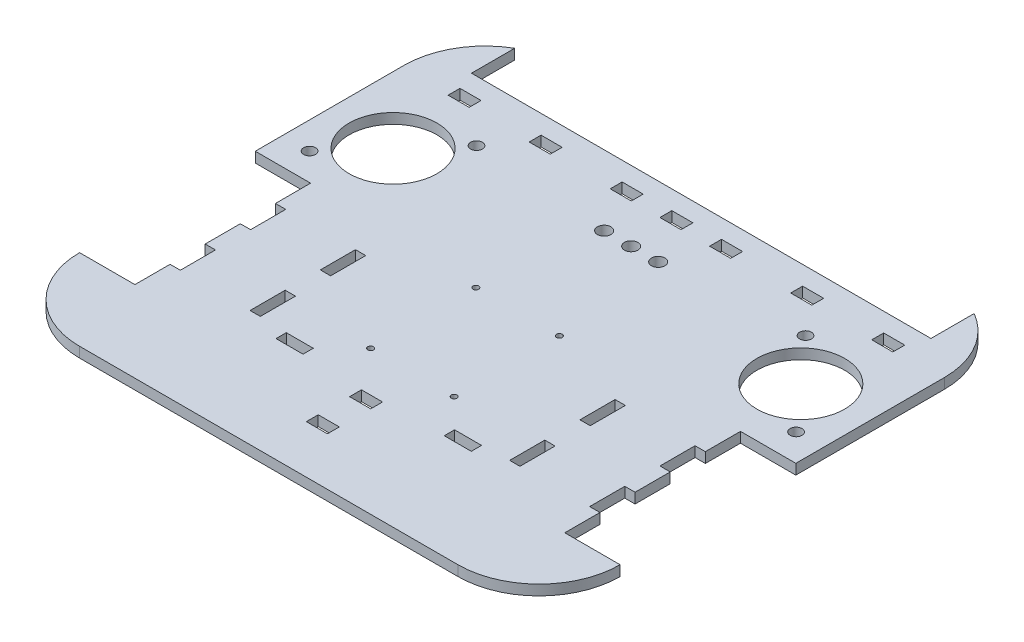
from build123d import *

# Parameters (mm, degrees)
SKETCH1_W           = 254
SKETCH1_H           = 228.6
BOSS_EXTRUDE1_DEPTH = 4.826
SKETCH2_W           = 26.00000007
SKETCH2_H           = 82.55
CUT_EXTRUDE1_DEPTH  = 4.826
CUT_EXTRUDE3_DEPTH  = 4.826
SKETCH7_W           = 215.9
SKETCH7_H           = 25.4
CUT_EXTRUDE5_DEPTH  = 4.826
CUT_EXTRUDE6_DEPTH  = 4.826
SKETCH10_W          = 4.826
SKETCH10_H          = 16.51
CUT_EXTRUDE8_DEPTH  = 171.929167423
SKETCH12_W          = 4.826
SKETCH12_H          = 16.51
CUT_EXTRUDE9_DEPTH  = 171.929167423
SKETCH13_W          = 4.826
SKETCH13_H          = 16.51
CUT_EXTRUDE10_DEPTH = 171.929167423
SKETCH15_R          = 1.3462
CUT_EXTRUDE11_DEPTH = 171.929167423
SKETCH16_R          = 2.778125
SKETCH16_R_2        = 20.6375
CUT_EXTRUDE12_DEPTH = 171.929167423
SKETCH17_W          = 9.906
SKETCH17_H          = 5.588
CUT_EXTRUDE13_DEPTH = 171.929167423
SKETCH18_W          = 9.906
SKETCH18_H          = 5.588
CUT_EXTRUDE14_DEPTH = 171.929167423
SKETCH19_R          = 3.175
CUT_EXTRUDE15_DEPTH = 171.929167423
SKETCH22_W          = 12.7
SKETCH22_H          = 4.826
CUT_EXTRUDE18_DEPTH = 171.929167423


with BuildPart() as part:
    # Sketch1 → Boss-Extrude1 (new body)
    with BuildSketch(Plane(origin=(0, 0, 0), x_dir=(1, 0, 0), z_dir=(0, 1, 0))):
        Rectangle(SKETCH1_W, SKETCH1_H)
    extrude(amount=BOSS_EXTRUDE1_DEPTH)

    # Sketch2 → Cut-Extrude1 (cut)
    with BuildSketch(Plane(origin=(0, 4.826, 0), x_dir=(1, 0, 0), z_dir=(0, 1, 0))):
        with Locations((-113.999999965, -34.925)):
            Rectangle(SKETCH2_W, SKETCH2_H)
        with Locations((113.999999965, -34.925)):
            Rectangle(SKETCH2_W, SKETCH2_H)
    extrude(amount=-CUT_EXTRUDE1_DEPTH, mode=Mode.SUBTRACT)

    # Sketch4 → Cut-Extrude3 (cut)
    with BuildSketch(Plane(origin=(0, 4.826, 0), x_dir=(1, 0, 0), z_dir=(0, 1, 0))):
        with BuildLine():
            Line((-127, 76.2), (-127, 114.3))
            Line((-127, 114.3), (-88.9, 114.3))
            ThreePointArc((-88.9, 114.3), (-115.840768363, 103.140768363), (-127, 76.2))
        make_face()
        with BuildLine():
            Line((127, 76.2), (127, 114.3))
            Line((127, 114.3), (88.9, 114.3))
            ThreePointArc((88.9, 114.3), (115.840768363, 103.140768363), (127, 76.2))
        make_face()
    extrude(amount=-CUT_EXTRUDE3_DEPTH, mode=Mode.SUBTRACT)

    # Sketch7 → Cut-Extrude5 (cut)
    with BuildSketch(Plane(origin=(0, 4.826, 0), x_dir=(1, 0, 0), z_dir=(0, 1, 0))):
        with Locations((0, 101.6)):
            Rectangle(SKETCH7_W, SKETCH7_H)
    extrude(amount=-CUT_EXTRUDE5_DEPTH, mode=Mode.SUBTRACT)

    # Sketch8 → Cut-Extrude6 (cut)
    with BuildSketch(Plane(origin=(0, 4.826, 0), x_dir=(1, 0, 0), z_dir=(0, 1, 0))):
        with BuildLine():
            Line((-127, -76.2), (-127, -114.3))
            Line((-127, -114.3), (-88.9, -114.3))
            ThreePointArc((-88.9, -114.3), (-115.840768363, -103.140768363), (-127, -76.2))
        make_face()
        with BuildLine():
            Line((127, -114.3), (88.9, -114.3))
            ThreePointArc((88.9, -114.3), (115.840768363, -103.140768363), (127, -76.2))
            Line((127, -76.2), (127, -114.3))
        make_face()
    extrude(amount=-CUT_EXTRUDE6_DEPTH, mode=Mode.SUBTRACT)

    # Sketch10 → Cut-Extrude8 (cut, through all)
    with BuildSketch(Plane(origin=(0, 4.826, 0), x_dir=(1, 0, 0), z_dir=(0, 1, 0))):
        with Locations((-98.58699993, -51.435)):
            Rectangle(SKETCH10_W, SKETCH10_H)
        with Locations((-98.58699993, -18.415)):
            Rectangle(SKETCH10_W, SKETCH10_H)
        with Locations((98.58699993, -18.415)):
            Rectangle(SKETCH10_W, SKETCH10_H)
        with Locations((98.58699993, -51.435)):
            Rectangle(SKETCH10_W, SKETCH10_H)
    extrude(amount=-CUT_EXTRUDE8_DEPTH, mode=Mode.SUBTRACT)

    # Sketch12 → Cut-Extrude9 (cut, through all)
    with BuildSketch(Plane.XZ):
        with Locations((-60.99499993, 51.435)):
            Rectangle(SKETCH12_W, SKETCH12_H)
        with Locations((-60.99499993, 18.415)):
            Rectangle(SKETCH12_W, SKETCH12_H)
    extrude(amount=-CUT_EXTRUDE9_DEPTH, mode=Mode.SUBTRACT)

    # Sketch13 → Cut-Extrude10 (cut, through all)
    with BuildSketch(Plane(origin=(0, 4.826, 0), x_dir=(1, 0, 0), z_dir=(0, 1, 0))):
        with Locations((60.99499993, -51.435)):
            Rectangle(SKETCH13_W, SKETCH13_H)
        with Locations((60.99499993, -18.415)):
            Rectangle(SKETCH13_W, SKETCH13_H)
    extrude(amount=-CUT_EXTRUDE10_DEPTH, mode=Mode.SUBTRACT)

    # Sketch15 → Cut-Extrude11 (cut, through all)
    with BuildSketch(Plane(origin=(0, 4.826, 0), x_dir=(1, 0, 0), z_dir=(0, 1, 0))):
        with Locations((19.5961, 2.669161094)):
            Circle(SKETCH15_R)
        with Locations((-19.6723, 2.669161094)):
            Circle(SKETCH15_R)
        with Locations((-19.6723, -46.763561094)):
            Circle(SKETCH15_R)
        with Locations((19.5961, -46.763561094)):
            Circle(SKETCH15_R)
    extrude(amount=-CUT_EXTRUDE11_DEPTH, mode=Mode.SUBTRACT)

    # Sketch16 → Cut-Extrude12 (cut, through all)
    with BuildSketch(Plane(origin=(0, 4.826, 0), x_dir=(1, 0, 0), z_dir=(0, 1, 0))):
        with Locations((77.293854564, 60.610218612)):
            Circle(SKETCH16_R)
        with Locations((114.3, 19.164632523)):
            Circle(SKETCH16_R)
        with Locations((95.796927282, 39.887425568)):
            Circle(SKETCH16_R_2)
        with Locations((-95.796927282, 39.887425568)):
            Circle(SKETCH16_R_2)
        with Locations((-77.293854564, 60.610218612)):
            Circle(SKETCH16_R)
        with Locations((-114.3, 19.164632523)):
            Circle(SKETCH16_R)
    extrude(amount=-CUT_EXTRUDE12_DEPTH, mode=Mode.SUBTRACT)

    # Sketch17 → Cut-Extrude13 (cut, through all)
    with BuildSketch(Plane(origin=(0, 4.826, 0), x_dir=(1, 0, 0), z_dir=(0, 1, 0))):
        with Locations((-61.445869789, 77.244822677)):
            Rectangle(SKETCH17_W, SKETCH17_H)
        with Locations((-99.545869789, 77.244822677)):
            Rectangle(SKETCH17_W, SKETCH17_H)
        with Locations((-23.345869789, 77.244822677)):
            Rectangle(SKETCH17_W, SKETCH17_H)
        with Locations((0, 77.244822677)):
            Rectangle(SKETCH17_W, SKETCH17_H)
        with Locations((23.345869789, 77.244822677)):
            Rectangle(SKETCH17_W, SKETCH17_H)
        with Locations((61.445869789, 77.244822677)):
            Rectangle(SKETCH17_W, SKETCH17_H)
        with Locations((99.545869789, 77.244822677)):
            Rectangle(SKETCH17_W, SKETCH17_H)
    extrude(amount=-CUT_EXTRUDE13_DEPTH, mode=Mode.SUBTRACT)

    # Sketch18 → Cut-Extrude14 (cut, through all)
    with BuildSketch(Plane(origin=(0, 4.826, 0), x_dir=(1, 0, 0), z_dir=(0, 1, 0))):
        with Locations((0, -88.9)):
            Rectangle(SKETCH18_W, SKETCH18_H)
        with Locations((0, -68.58)):
            Rectangle(SKETCH18_W, SKETCH18_H)
    extrude(amount=-CUT_EXTRUDE14_DEPTH, mode=Mode.SUBTRACT)

    # Sketch19 → Cut-Extrude15 (cut, through all)
    with BuildSketch(Plane(origin=(0, 4.826, 0), x_dir=(1, 0, 0), z_dir=(0, 1, 0))):
        with Locations((0, 55.982011538)):
            Circle(SKETCH19_R)
        with Locations((12.7, 55.982011538)):
            Circle(SKETCH19_R)
        with Locations((-12.7, 55.982011538)):
            Circle(SKETCH19_R)
    extrude(amount=-CUT_EXTRUDE15_DEPTH, mode=Mode.SUBTRACT)

    # Sketch22 → Cut-Extrude18 (cut, through all)
    with BuildSketch(Plane.XZ):
        with Locations((-39.53199993, 62.611)):
            Rectangle(SKETCH22_W, SKETCH22_H)
        with Locations((39.53199993, 62.611)):
            Rectangle(SKETCH22_W, SKETCH22_H)
    extrude(amount=-CUT_EXTRUDE18_DEPTH, mode=Mode.SUBTRACT)


solid = part.part
